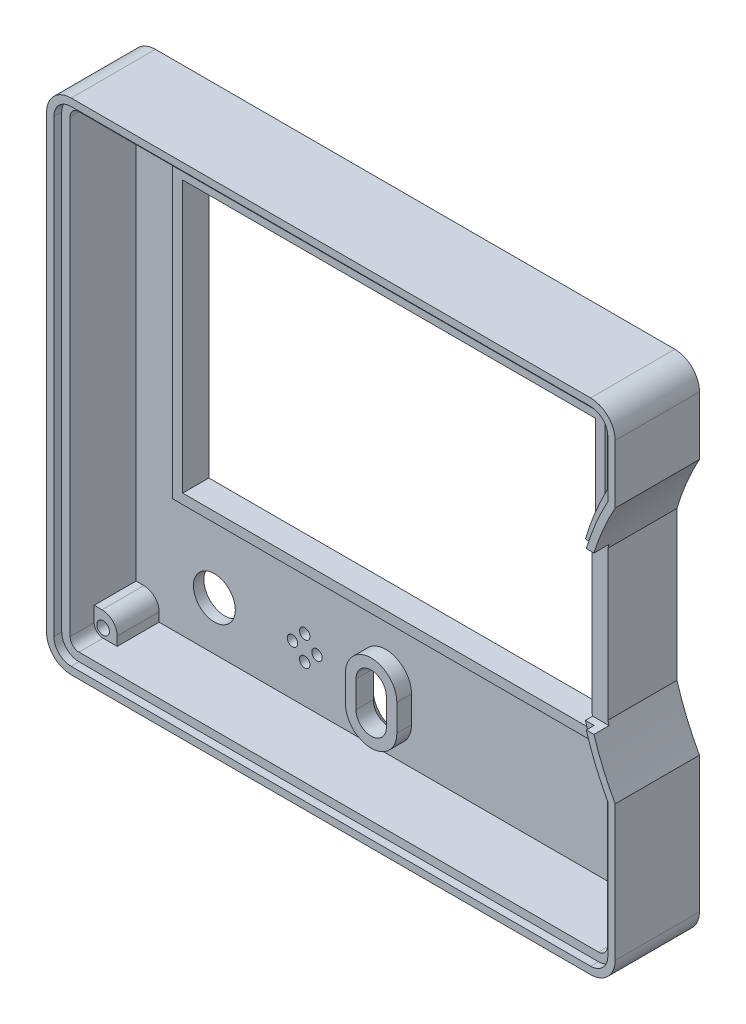
from build123d import *

# Parameters (mm, degrees)
SKETCH1_W                = 108.6
SKETCH1_H                = 95.4
BOSS_EXTRUDE1_DEPTH      = 16.1
CUT_EXTRUDE1_DEPTH       = 75.047214667
FILLET1_R                = 4.7
SHELL1_T                 = -3
SHELL1_THICKNESS_2_DEPTH = 1
CUT_EXTRUDE2_DEPTH       = 1.5
SKETCH4_W                = 78.8
SKETCH4_H                = 51.8
CUT_EXTRUDE3_DEPTH       = 74.63823735
SKETCH5_W                = 82.6
SKETCH5_H                = 55.6
SKETCH5_W_2              = 78.8
SKETCH5_H_2              = 51.8
BOSS_EXTRUDE2_DEPTH      = 3
SKETCH6_R                = 4
SKETCH6_R_2              = 1
CUT_EXTRUDE4_DEPTH       = 74.63823735
BOSS_EXTRUDE3_START      = 2.8
BOSS_EXTRUDE3_DEPTH      = 2.8
CHAMFER1_SIZE            = 1.5
CUT_EXTRUDE5_REACH       = 121.702
SKETCH8_W                = 2.9
SKETCH8_H                = 30
BOSS_EXTRUDE4_START      = 8
BOSS_EXTRUDE4_DEPTH      = 8
FILLET2_R                = 2.9
SKETCH10_R               = 1.21
CUT_EXTRUDE6_DEPTH       = 9


with BuildPart() as part:
    # Sketch1 → Boss-Extrude1 (new body)
    with BuildSketch(Plane.XY):
        Rectangle(SKETCH1_W, SKETCH1_H)
    extrude(amount=BOSS_EXTRUDE1_DEPTH)

    # Sketch2 → Cut-Extrude1 (cut, through all)
    with BuildSketch(Plane.XY.offset(16.1)):
        with BuildLine():
            Line((50.011, -6.861266451), (50.011, 21.582126451))
            ThreePointArc((50.011, 21.582126451), (148.66075, 7.36043), (50.011, -6.861266451))
        make_face()
    extrude(amount=-CUT_EXTRUDE1_DEPTH, mode=Mode.SUBTRACT)

    # Fillet1
    fillet1_edges = [part.edges().sort_by_distance(p)[0] for p in [
        (-54.3, -47.7, 8.05),
        (54.3, -47.7, 8.05),
        (-54.3, 47.7, 8.05),
        (54.3, 47.7, 8.05),
    ]]
    fillet(fillet1_edges, radius=FILLET1_R)

    # Shell1
    shell1_openings = [part.faces().sort_by_distance(p)[0] for p in [
        (-0.877010034, -0.123339484, 16.1),
    ]]
    offset(amount=SHELL1_T, openings=shell1_openings, kind=Kind.INTERSECTION)

    # Shell1 thickness 2 face (on inner face of the shell) → Shell1 thickness 2 (cut)
    with BuildSketch(Plane(origin=(-0.963593996, -0.143755332, 3), x_dir=(-1, 0, 0), z_dir=(0, 0, -1))):
        with BuildLine():
            Line((50.336406004, 43.143755332), (50.336406004, -42.856244668))
            ThreePointArc((50.336406004, -42.856244668), (49.838487532, -44.058326196), (48.636406004, -44.556244668))
            Line((48.636406004, -44.556244668), (-50.563593996, -44.556244668))
            ThreePointArc((-50.563593996, -44.556244668), (-51.765675524, -44.058326196), (-52.263593996, -42.856244668))
            Line((-52.263593996, -42.856244668), (-52.263593996, -17.719055626))
            ThreePointArc((-52.263593996, -17.719055626), (-49.835507324, -12.546349038), (-47.974593996, -7.143618255))
            Line((-47.974593996, -7.143618255), (-47.974593996, 22.151988919))
            ThreePointArc((-47.974593996, 22.151988919), (-49.835507324, 27.554719702), (-52.263593996, 32.72742629))
            Line((-52.263593996, 32.72742629), (-52.263593996, 43.143755332))
            ThreePointArc((-52.263593996, 43.143755332), (-51.765675524, 44.34583686), (-50.563593996, 44.843755332))
            Line((-50.563593996, 44.843755332), (48.636406004, 44.843755332))
            ThreePointArc((48.636406004, 44.843755332), (49.838487532, 44.34583686), (50.336406004, 43.143755332))
        make_face()
    extrude(amount=SHELL1_THICKNESS_2_DEPTH, mode=Mode.SUBTRACT)

    # Sketch3 → Cut-Extrude2 (cut)
    with BuildSketch(Plane.XY.offset(16.1)):
        with BuildLine():
            Line((-51.3, 43), (-51.3, -43))
            ThreePointArc((-51.3, -43), (-50.802081528, -44.202081528), (-49.6, -44.7))
            Line((-49.6, -44.7), (49.6, -44.7))
            ThreePointArc((49.6, -44.7), (50.802081528, -44.202081528), (51.3, -43))
            Line((51.3, -43), (51.3, -17.862810958))
            ThreePointArc((51.3, -17.862810958), (48.786619627, -12.478496653), (46.887595336, -6.84807676))
            Line((46.887595336, -6.84807676), (48.549511715, -6.84807676))
            ThreePointArc((48.549511715, -6.84807676), (50.429997664, -12.273623472), (52.9, -17.457432205))
            Line((52.9, -17.457432205), (52.9, -43))
            ThreePointArc((52.9, -43), (51.933452378, -45.333452378), (49.6, -46.3))
            Line((49.6, -46.3), (-49.6, -46.3))
            ThreePointArc((-49.6, -46.3), (-51.933452378, -45.333452378), (-52.9, -43))
            Line((-52.9, -43), (-52.9, 43))
            ThreePointArc((-52.9, 43), (-51.933452378, 45.333452378), (-49.6, 46.3))
            Line((-49.6, 46.3), (49.6, 46.3))
            ThreePointArc((49.6, 46.3), (51.933452378, 45.333452378), (52.9, 43))
            Line((52.9, 43), (52.9, 32.178292205))
            ThreePointArc((52.9, 32.178292205), (50.429997664, 26.994483472), (48.549511715, 21.56893676))
            Line((48.549511715, 21.56893676), (46.887595336, 21.56893676))
            ThreePointArc((46.887595336, 21.56893676), (48.786619627, 27.199356653), (51.3, 32.583670958))
            Line((51.3, 32.583670958), (51.3, 43))
            ThreePointArc((51.3, 43), (50.802081528, 44.202081528), (49.6, 44.7))
            Line((49.6, 44.7), (-49.6, 44.7))
            ThreePointArc((-49.6, 44.7), (-50.802081528, 44.202081528), (-51.3, 43))
        make_face()
    extrude(amount=-CUT_EXTRUDE2_DEPTH, mode=Mode.SUBTRACT)

    # Sketch4 → Cut-Extrude3 (cut, through all)
    with BuildSketch(Plane.XY.offset(2)):
        with Locations((0, 7.8)):
            Rectangle(SKETCH4_W, SKETCH4_H)
    extrude(amount=-CUT_EXTRUDE3_DEPTH, mode=Mode.SUBTRACT)

    # Sketch5 → Boss-Extrude2 (add)
    with BuildSketch(Plane.XY.offset(2)):
        with Locations((0, 7.8)):
            Rectangle(SKETCH5_W, SKETCH5_H)
        with Locations((0, 7.8)):
            Rectangle(SKETCH5_W_2, SKETCH5_H_2, mode=Mode.SUBTRACT)
    extrude(amount=BOSS_EXTRUDE2_DEPTH)

    # Sketch6 → Cut-Extrude4 (cut, through all)
    with BuildSketch(Plane.XY.offset(2)):
        with Locations((-36.35, -35.4)):
            Circle(SKETCH6_R)
        with Locations((-19.08998, -32.69324)):
            Circle(SKETCH6_R_2)
        with Locations((-19.08998, -37.3744)):
            Circle(SKETCH6_R_2)
        with Locations((-21.43056, -35.03382)):
            Circle(SKETCH6_R_2)
        with Locations((-16.7494, -35.03382)):
            Circle(SKETCH6_R_2)
        with BuildLine():
            Line((-0.7, -32.46283), (-0.7, -37.6))
            ThreePointArc((-0.7, -37.6), (-3.6, -40.5), (-6.5, -37.6))
            Line((-6.5, -37.6), (-6.5, -32.46283))
            ThreePointArc((-6.5, -32.46283), (-3.6, -29.56283), (-0.7, -32.46283))
        make_face()
    extrude(amount=-CUT_EXTRUDE4_DEPTH, mode=Mode.SUBTRACT)

    # Sketch7 → Boss-Extrude3 (add)
    with BuildSketch(Plane.XY.offset(2).offset(BOSS_EXTRUDE3_START)):
        with BuildLine():
            Line((-8.5, -32.46283), (-8.5, -37.6))
            ThreePointArc((-8.5, -37.6), (-3.6, -42.5), (1.3, -37.6))
            Line((1.3, -37.6), (1.3, -32.46283))
            ThreePointArc((1.3, -32.46283), (-3.6, -27.56283), (-8.5, -32.46283))
        make_face()
        with BuildLine():
            Line((-6.5, -32.46283), (-6.5, -37.6))
            ThreePointArc((-6.5, -37.6), (-3.6, -40.5), (-0.7, -37.6))
            Line((-0.7, -37.6), (-0.7, -32.46283))
            ThreePointArc((-0.7, -32.46283), (-3.6, -29.56283), (-6.5, -32.46283))
        make_face(mode=Mode.SUBTRACT)
    extrude(amount=-BOSS_EXTRUDE3_DEPTH)

    # Chamfer1
    chamfer1_edges = [part.edges().sort_by_distance(p)[0] for p in [
        (-0.7, -35.031415, 0),
        (-3.6, -29.56283, 0),
        (-3.6, -40.5, 0),
        (-6.5, -35.031415, 0),
    ]]
    chamfer(chamfer1_edges, length=CHAMFER1_SIZE)

    # Sketch8 → Cut-Extrude5 (cut, up to next)
    with BuildSketch(Plane(origin=(54.3, 0, 0), x_dir=(0, 0, -1), z_dir=(1, 0, 0)), mode=Mode.PRIVATE) as cut_extrude5_sk1:
        with Locations((-14.65, 7.36043)):
            Rectangle(SKETCH8_W, SKETCH8_H)
    cut_extrude5_tool1 = extrude(cut_extrude5_sk1.sketch, amount=-CUT_EXTRUDE5_REACH, mode=Mode.PRIVATE) & part.part
    add(cut_extrude5_tool1.solids().sort_by_distance((54.3, 7.36043, 14.65))[0], mode=Mode.SUBTRACT)

    # Sketch9 → Boss-Extrude4 (add)
    with BuildSketch(Plane.XY.offset(2).offset(BOSS_EXTRUDE4_START)):
        with BuildLine():
            Line((49.6, 44.7), (46.9, 44.7))
            Line((46.9, 44.7), (46.9, 40.1))
            Line((46.9, 40.1), (51.3, 40.1))
            Line((51.3, 40.1), (51.3, 43))
            ThreePointArc((51.3, 43), (50.802081528, 44.202081528), (49.6, 44.7))
        make_face()
        with BuildLine():
            Line((-51.3, 40.1), (-46.9, 40.1))
            Line((-46.9, 40.1), (-46.9, 44.7))
            Line((-46.9, 44.7), (-49.6, 44.7))
            ThreePointArc((-49.6, 44.7), (-50.802081528, 44.202081528), (-51.3, 43))
            Line((-51.3, 43), (-51.3, 40.1))
        make_face()
        with BuildLine():
            Line((-51.3, -43), (-51.3, -40.1))
            Line((-51.3, -40.1), (-46.9, -40.1))
            Line((-46.9, -40.1), (-46.9, -44.7))
            Line((-46.9, -44.7), (-49.6, -44.7))
            ThreePointArc((-49.6, -44.7), (-50.802081528, -44.202081528), (-51.3, -43))
        make_face()
        with BuildLine():
            Line((49.6, -44.7), (46.9, -44.7))
            Line((46.9, -44.7), (46.9, -40.1))
            Line((46.9, -40.1), (51.3, -40.1))
            Line((51.3, -40.1), (51.3, -43))
            ThreePointArc((51.3, -43), (50.802081528, -44.202081528), (49.6, -44.7))
        make_face()
    extrude(amount=-BOSS_EXTRUDE4_DEPTH)

    # Fillet2
    fillet2_edges = [part.edges().sort_by_distance(p)[0] for p in [
        (-46.9, 40.1, 6),
        (46.9, 40.1, 6),
        (46.9, -40.1, 6),
        (-46.9, -40.1, 6),
    ]]
    fillet(fillet2_edges, radius=FILLET2_R)

    # Sketch10 → Cut-Extrude6 (cut)
    with BuildSketch(Plane.XY.offset(10)):
        with Locations((-49.6, 43)):
            Circle(SKETCH10_R)
        with Locations((49.6, 43)):
            Circle(SKETCH10_R)
        with Locations((49.6, -43)):
            Circle(SKETCH10_R)
        with Locations((-49.6, -43)):
            Circle(SKETCH10_R)
    extrude(amount=-CUT_EXTRUDE6_DEPTH, mode=Mode.SUBTRACT)


solid = part.part
